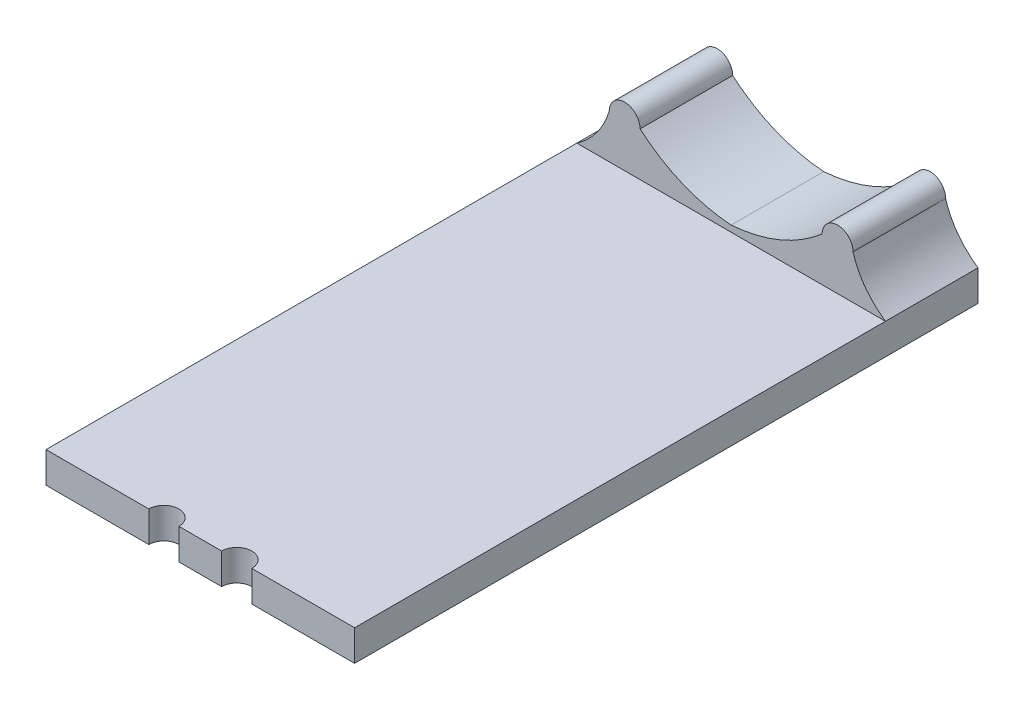
from build123d import *

# Parameters (mm, degrees)
BOSS_EXTRUDE1_DEPTH = 9.525
SKETCH4_W           = 63.5
SKETCH4_H           = 6.35
BOSS_EXTRUDE2_DEPTH = 109.22
SKETCH5_R           = 3.1
CUT_EXTRUDE1_DEPTH  = 124.522339287


with BuildPart() as part:
    # Sketch1 → Boss-Extrude1 (new, symmetric)
    with BuildSketch(Plane.XY):
        with BuildLine():
            Line((-31.75, -46.99), (-31.75, -53.34))
            Line((-31.75, -53.34), (31.75, -53.34))
            Line((31.75, -53.34), (31.75, -46.99))
            add(Edge.make_bspline(
                [(25.0825, -37.944903067), (26.74863761, -43.489498236), (31.75, -46.99)],
                knots=[0, 0, 0, 1, 1, 1], degree=2))
            ThreePointArc((25.0825, -37.944903067), (21.9075, -34.769903067), (18.7325, -37.944903067))
            add(Edge.make_bspline(
                [(18.7325, -37.944903067), (10.633340365, -44.866866243), (0, -45.72)],
                knots=[0, 0, 0, 1, 1, 1], degree=2))
            add(Edge.make_bspline(
                [(-18.7325, -37.944903067), (-10.633340365, -44.866866243), (0, -45.72)],
                knots=[0, 0, 0, 1, 1, 1], degree=2))
            ThreePointArc((-18.7325, -37.944903067), (-21.9075, -34.769903067), (-25.0825, -37.944903067))
            add(Edge.make_bspline(
                [(-25.0825, -37.944903067), (-26.74863761, -43.489498236), (-31.75, -46.99)],
                knots=[0, 0, 0, 1, 1, 1], degree=2))
        make_face()
    extrude(amount=BOSS_EXTRUDE1_DEPTH, both=True)

    # Sketch4 → Boss-Extrude2 (add)
    with BuildSketch(Plane.XY.offset(9.525)):
        with Locations((0, -50.165)):
            Rectangle(SKETCH4_W, SKETCH4_H)
    extrude(amount=BOSS_EXTRUDE2_DEPTH)

    # Sketch5 → Cut-Extrude1 (cut, through all)
    with BuildSketch(Plane(origin=(0, -46.99, 0), x_dir=(1, 0, 0), z_dir=(0, 1, 0))):
        with Locations((7.5, -118.745)):
            Circle(SKETCH5_R)
        with Locations((-7.5, -118.745)):
            Circle(SKETCH5_R)
    extrude(amount=-CUT_EXTRUDE1_DEPTH, mode=Mode.SUBTRACT)


solid = part.part
